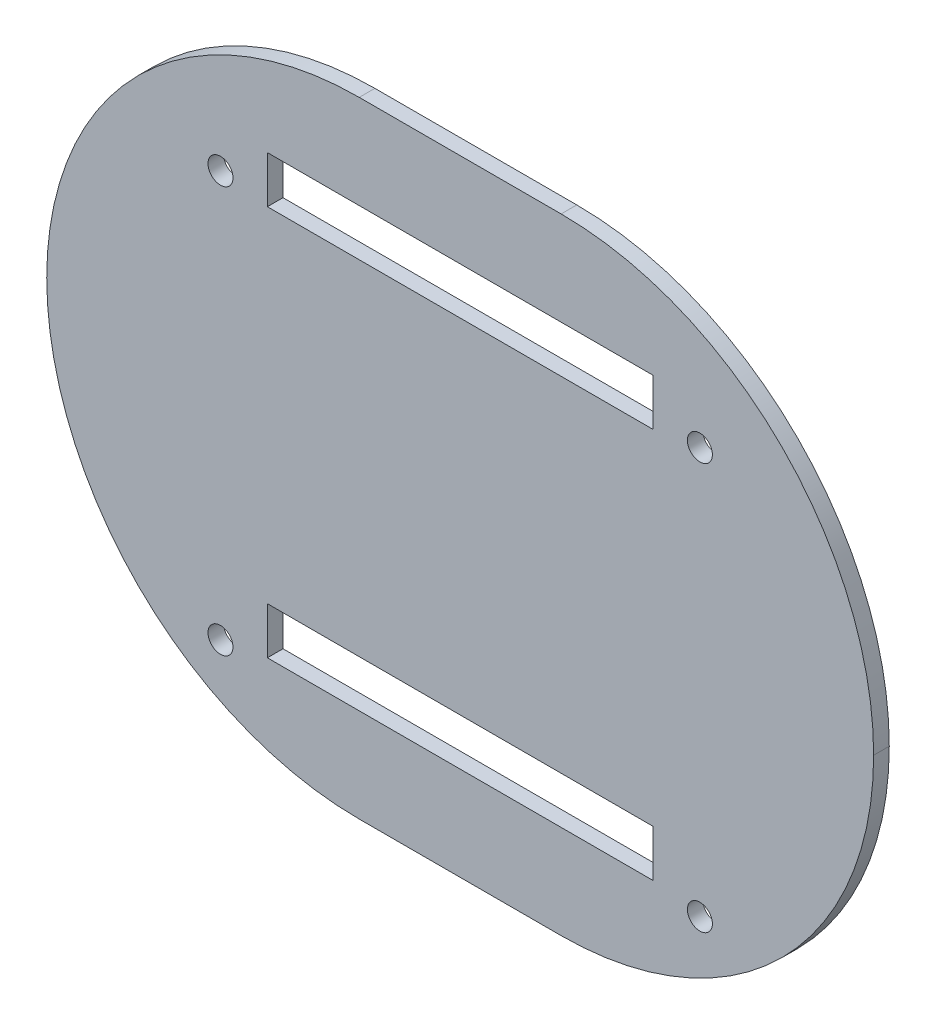
from build123d import *

# Parameters (mm, degrees)
ESQUISSE1_W             = 295
ESQUISSE1_H             = 260
BOSS_EXTRU_1_DEPTH      = 5
ESQUISSE3_OUTSIDE_W     = 375.652
ESQUISSE3_OUTSIDE_H     = 340.652
ESQUISSE3_OUTSIDE_W_2   = 264.6
ESQUISSE3_OUTSIDE_H_2   = 200
ENL_V_MAT_EXTRU_2_DEPTH = 394.255642045
CONG_1_R                = 100
ENL_V_MAT_EXTRU_4_DEPTH = 363.233405417
ESQUISSE7_W             = 123.401082374
ESQUISSE7_H             = 15
ENL_V_MAT_EXTRU_6_DEPTH = 363.233405417


with BuildPart() as part:
    # Esquisse1 → Boss.-Extru.1 (new body)
    with BuildSketch(Plane.XY):
        with Locations((-147.5, -130)):
            Rectangle(ESQUISSE1_W, ESQUISSE1_H)
    extrude(amount=BOSS_EXTRU_1_DEPTH)

    # Esquisse3 outside → Enlèv. mat.-Extru.2 (cut, through all)
    with BuildSketch(Plane(origin=(0, 0, 0), x_dir=(-1, 0, 0), z_dir=(0, 0, -1))):
        with Locations((147.5, -130)):
            Rectangle(ESQUISSE3_OUTSIDE_W, ESQUISSE3_OUTSIDE_H)
        with Locations((147.5, -130)):
            Rectangle(ESQUISSE3_OUTSIDE_W_2, ESQUISSE3_OUTSIDE_H_2, mode=Mode.SUBTRACT)
    extrude(amount=-ENL_V_MAT_EXTRU_2_DEPTH, mode=Mode.SUBTRACT)

    # Congé1
    cong_1_edges = [part.edges().sort_by_distance(p)[0] for p in [
        (-279.8, -30, 2.5),
        (-15.2, -30, 2.5),
        (-279.8, -230, 2.5),
        (-15.2, -230, 2.5),
    ]]
    fillet(cong_1_edges, radius=CONG_1_R - 0.0001)  # a hair under: the kernel refuses the full size

    # Esquisse5 → Enlèv. mat.-Extru.4 (cut, through all)
    with BuildSketch(Plane.XY.offset(5)):
        with BuildLine():
            ThreePointArc((-70.799458813, -198.530608435), (-73.627885938, -199.70218131), (-74.799458813, -202.530608435))
            Line((-74.799458813, -202.530608435), (-70.799458813, -202.530608435))
            Line((-70.799458813, -202.530608435), (-70.799458813, -198.530608435))
        make_face()
        with BuildLine():
            Line((-70.799458813, -202.530608435), (-74.799458813, -202.530608435))
            ThreePointArc((-74.799458813, -202.530608435), (-70.799458813, -206.530608435), (-66.799458813, -202.530608435))
            ThreePointArc((-66.799458813, -202.530608435), (-67.971031689, -199.70218131), (-70.799458813, -198.530608435))
            Line((-70.799458813, -198.530608435), (-70.799458813, -202.530608435))
        make_face()
        with BuildLine():
            ThreePointArc((-224.200541187, -198.530608435), (-227.028968311, -205.35903556), (-220.200541187, -202.530608435))
            Line((-220.200541187, -202.530608435), (-224.200541187, -202.530608435))
            Line((-224.200541187, -202.530608435), (-224.200541187, -198.530608435))
        make_face()
        with BuildLine():
            Line((-224.200541187, -202.530608435), (-220.200541187, -202.530608435))
            ThreePointArc((-220.200541187, -202.530608435), (-221.372114062, -199.70218131), (-224.200541187, -198.530608435))
            Line((-224.200541187, -198.530608435), (-224.200541187, -202.530608435))
        make_face()
        with BuildLine():
            ThreePointArc((-220.200541187, -72.530608435), (-227.028968311, -69.70218131), (-224.200541187, -76.530608435))
            Line((-224.200541187, -76.530608435), (-224.200541187, -72.530608435))
            Line((-224.200541187, -72.530608435), (-220.200541187, -72.530608435))
        make_face()
        with BuildLine():
            Line((-224.200541187, -72.530608435), (-224.200541187, -76.530608435))
            ThreePointArc((-224.200541187, -76.530608435), (-221.372114062, -75.35903556), (-220.200541187, -72.530608435))
            Line((-220.200541187, -72.530608435), (-224.200541187, -72.530608435))
        make_face()
        with BuildLine():
            ThreePointArc((-74.799458813, -72.530608435), (-73.627885938, -75.35903556), (-70.799458813, -76.530608435))
            Line((-70.799458813, -76.530608435), (-70.799458813, -72.530608435))
            Line((-70.799458813, -72.530608435), (-74.799458813, -72.530608435))
        make_face()
        with BuildLine():
            Line((-70.799458813, -72.530608435), (-70.799458813, -76.530608435))
            ThreePointArc((-70.799458813, -76.530608435), (-67.971031689, -75.35903556), (-66.799458813, -72.530608435))
            ThreePointArc((-66.799458813, -72.530608435), (-70.799458813, -68.530608435), (-74.799458813, -72.530608435))
            Line((-74.799458813, -72.530608435), (-70.799458813, -72.530608435))
        make_face()
    extrude(amount=-ENL_V_MAT_EXTRU_4_DEPTH, mode=Mode.SUBTRACT)

    # Esquisse7 → Enlèv. mat.-Extru.6 (cut, through all)
    with BuildSketch(Plane(origin=(0, 0, 0), x_dir=(-1, 0, 0), z_dir=(0, 0, -1))):
        with Locations((147.5, -67.5)):
            Rectangle(ESQUISSE7_W, ESQUISSE7_H)
        with Locations((147.5, -192.5)):
            Rectangle(ESQUISSE7_W, ESQUISSE7_H)
    extrude(amount=-ENL_V_MAT_EXTRU_6_DEPTH, mode=Mode.SUBTRACT)


solid = part.part
